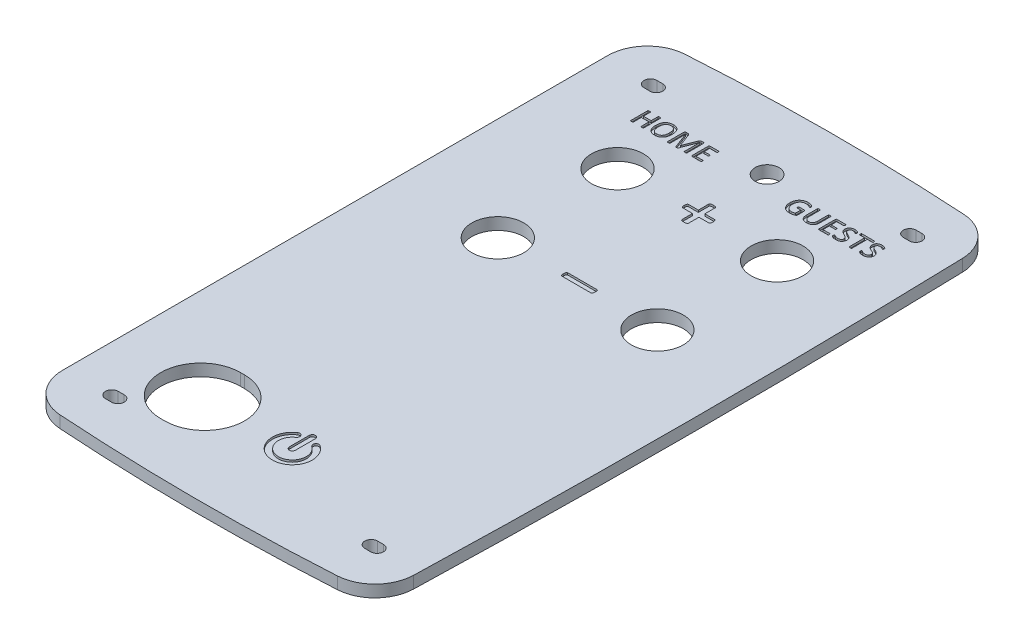
from build123d import *

# Parameters (mm, degrees)
BOSS_EXTRUDE1_DEPTH = 3
BOSS_EXTRUDE2_DEPTH = 17
SKETCH2_R           = 1.6
CUT_EXTRUDE1_DEPTH  = 94.910452487
SKETCH3_R           = 6.5
SKETCH3_R_2         = 10
SKETCH3_R_3         = 3
CUT_EXTRUDE2_DEPTH  = 94.910452487
CUT_EXTRUDE3_DEPTH  = 94.910452487
CUT_EXTRUDE4_DEPTH  = 0.5
SKETCH7_W           = 101.283018643
SKETCH7_H           = 178.660728539
CUT_EXTRUDE5_DEPTH  = 20


with BuildPart() as part:
    # Sketch1 → Boss-Extrude1 (new body)
    with BuildSketch(Plane(origin=(0, 0, 0), x_dir=(1, 0, 0), z_dir=(0, 1, 0))):
        with BuildLine():
            Line((-45.796334169, 68.322010608), (-45.796334169, -68.322010608))
            ThreePointArc((-45.796334169, -68.322010608), (-43.098087267, -75.154609066), (-36.459453831, -78.3))
            ThreePointArc((-36.459453831, -78.3), (-1.576004719, -79.507922129), (33.313795952, -78.5))
            ThreePointArc((33.313795952, -78.5), (39.889666899, -75.4769697), (42.703665831, -68.808971431))
            ThreePointArc((42.703665831, -68.808971431), (43.703665831, 0), (42.703665831, 68.808971431))
            ThreePointArc((42.703665831, 68.808971431), (39.889666899, 75.4769697), (33.313795952, 78.5))
            ThreePointArc((33.313795952, 78.5), (-1.576004719, 79.507922129), (-36.459453831, 78.3))
            ThreePointArc((-36.459453831, 78.3), (-43.098087267, 75.154609066), (-45.796334169, 68.322010608))
        make_face()
    extrude(amount=BOSS_EXTRUDE1_DEPTH)


with BuildPart() as body_2:
    # Sketch1<2> → Boss-Extrude2 (new body)
    with BuildSketch(Plane(origin=(0, 0, 0), x_dir=(1, 0, 0), z_dir=(0, 1, 0))):
        with BuildLine():
            Line((-45.796334169, 68.322010608), (-45.796334169, -68.322010608))
            ThreePointArc((-45.796334169, -68.322010608), (-43.098087267, -75.154609066), (-36.459453831, -78.3))
            ThreePointArc((-36.459453831, -78.3), (-1.576004719, -79.507922129), (33.313795952, -78.5))
            ThreePointArc((33.313795952, -78.5), (39.889666899, -75.4769697), (42.703665831, -68.808971431))
            ThreePointArc((42.703665831, -68.808971431), (43.703665831, 0), (42.703665831, 68.808971431))
            ThreePointArc((42.703665831, 68.808971431), (39.889666899, 75.4769697), (33.313795952, 78.5))
            ThreePointArc((33.313795952, 78.5), (-1.576004719, 79.507922129), (-36.459453831, 78.3))
            ThreePointArc((-36.459453831, 78.3), (-43.098087267, 75.154609066), (-45.796334169, 68.322010608))
        make_face()
    extrude(amount=-BOSS_EXTRUDE2_DEPTH)


with BuildPart() as cut_extrude1_tool:
    # Sketch2 → Cut-Extrude1 (new, through all)
    with BuildSketch(Plane(origin=(0, 3, 0), x_dir=(1, 0, 0), z_dir=(0, 1, 0))):
        with Locations((-33.5, 67.5)):
            Circle(SKETCH2_R)
        with Locations((-33.5, -67.5)):
            Circle(SKETCH2_R)
        with Locations((31.5, -67.5)):
            Circle(SKETCH2_R)
        with Locations((31.5, 67.5)):
            Circle(SKETCH2_R)
    extrude(amount=-CUT_EXTRUDE1_DEPTH)


with BuildPart() as part_1:
    add(part.part)

    # Cut-Extrude1: cut by cut_extrude1_tool
    add(cut_extrude1_tool.part, mode=Mode.SUBTRACT)


with BuildPart() as body_2_1:
    add(body_2.part)

    # Cut-Extrude1: cut by cut_extrude1_tool
    add(cut_extrude1_tool.part, mode=Mode.SUBTRACT)


with BuildPart() as cut_extrude2_tool:
    # Sketch3 → Cut-Extrude2 (new, through all)
    with BuildSketch(Plane(origin=(0, 3, 0), x_dir=(1, 0, 0), z_dir=(0, 1, 0))):
        with Locations((20, 45)):
            Circle(SKETCH3_R)
        with Locations((-20, 45)):
            Circle(SKETCH3_R)
        with Locations((20, 15)):
            Circle(SKETCH3_R)
        with Locations((-20, 15)):
            Circle(SKETCH3_R)
        with Locations((-22.5, -56.5)):
            Circle(SKETCH3_R_2)
        with Locations((0, 62.5)):
            Circle(SKETCH3_R_3)
    extrude(amount=-CUT_EXTRUDE2_DEPTH)


with BuildPart() as part_2:
    add(part_1.part)

    # Cut-Extrude2: cut by cut_extrude2_tool
    add(cut_extrude2_tool.part, mode=Mode.SUBTRACT)


with BuildPart() as body_2_2:
    add(body_2_1.part)

    # Cut-Extrude2: cut by cut_extrude2_tool
    add(cut_extrude2_tool.part, mode=Mode.SUBTRACT)


with BuildPart() as cut_extrude3_tool:
    # Sketch4 → Cut-Extrude3 (new, through all)
    with BuildSketch(Plane(origin=(0, 3, 0), x_dir=(1, 0, 0), z_dir=(0, 1, 0))):
        with BuildLine():
            Line((-23, -46.5), (-22, -46.5))
            ThreePointArc((-22, -46.5), (-12, -56.5), (-22, -66.5))
            Line((-22, -66.5), (-23, -66.5))
            ThreePointArc((-23, -66.5), (-33, -56.5), (-23, -46.5))
        make_face()
        with BuildLine():
            Line((-34.25, -65.9), (-32.75, -65.9))
            ThreePointArc((-32.75, -65.9), (-31.15, -67.5), (-32.75, -69.1))
            Line((-32.75, -69.1), (-34.25, -69.1))
            ThreePointArc((-34.25, -69.1), (-35.85, -67.5), (-34.25, -65.9))
        make_face()
        with BuildLine():
            Line((30.75, -65.9), (32.25, -65.9))
            ThreePointArc((32.25, -65.9), (33.85, -67.5), (32.25, -69.1))
            Line((32.25, -69.1), (30.75, -69.1))
            ThreePointArc((30.75, -69.1), (29.15, -67.5), (30.75, -65.9))
        make_face()
        with BuildLine():
            Line((-34.25, 69.1), (-32.75, 69.1))
            ThreePointArc((-32.75, 69.1), (-31.15, 67.5), (-32.75, 65.9))
            Line((-32.75, 65.9), (-34.25, 65.9))
            ThreePointArc((-34.25, 65.9), (-35.85, 67.5), (-34.25, 69.1))
        make_face()
        with BuildLine():
            Line((30.75, 69.1), (32.25, 69.1))
            ThreePointArc((32.25, 69.1), (33.85, 67.5), (32.25, 65.9))
            Line((32.25, 65.9), (30.75, 65.9))
            ThreePointArc((30.75, 65.9), (29.15, 67.5), (30.75, 69.1))
        make_face()
    extrude(amount=-CUT_EXTRUDE3_DEPTH)


with BuildPart() as part_3:
    add(part_2.part)

    # Cut-Extrude3: cut by cut_extrude3_tool
    add(cut_extrude3_tool.part, mode=Mode.SUBTRACT)

    # Sketch6 → Cut-Extrude4 (cut)
    # profile 1 of 14: a face of its own
    with BuildSketch(Plane(origin=(0, 3, 0), x_dir=(1, 0, 0), z_dir=(0, 1, 0))):
        with BuildLine():
            Line((0.75, -51.5), (0.75, -56.5))
            ThreePointArc((0.75, -56.5), (0, -57.25), (-0.75, -56.5))
            Line((-0.75, -56.5), (-0.75, -51.5))
            ThreePointArc((-0.75, -51.5), (0, -50.75), (0.75, -51.5))
        make_face()
    # profile 2 of 14: a face of its own
    with BuildSketch(Plane(origin=(0, 3, 0), x_dir=(1, 0, 0), z_dir=(0, 1, 0))):
        with BuildLine():
            ThreePointArc((-2.836367871, -52.382352941), (0, -61.5), (2.836367871, -52.382352941))
            ThreePointArc((2.836367871, -52.382352941), (1.793265631, -52.574544819), (1.98545751, -53.617647059))
            ThreePointArc((1.98545751, -53.617647059), (0, -60), (-1.98545751, -53.617647059))
            ThreePointArc((-1.98545751, -53.617647059), (-1.793265631, -52.574544819), (-2.836367871, -52.382352941))
        make_face()
    # profile 3 of 14: a face of its own
    with BuildSketch(Plane(origin=(0, 3, 0), x_dir=(1, 0, 0), z_dir=(0, 1, 0))):
        with BuildLine():
            add(Edge.make_bspline(
                [(-25.558823529, 57.110638787), (-25.559684608, 57.10191743), (-25.561382235, 57.084723161), (-25.573400426, 57.059897318), (-25.597507046, 57.040755251), (-25.631830038, 57.02672435), (-25.677936125, 57.017804608), (-25.735188165, 57.006450632), (-25.806895175, 57.001010036), (-25.859028245, 57.000357887), (-25.887637868, 57)],
                knots=[0, 0, 0, 0, 0.555183087, 1.094550744, 1.701060695, 2.466987252, 3.435071453, 4.68248791, 6.179413357, 8, 8, 8, 8], degree=3))
            add(Edge.make_bspline(
                [(-25.887637868, 57), (-25.917967673, 57.000347602), (-25.972162383, 57.000968713), (-26.045294027, 57.006222938), (-26.10258037, 57.017855015), (-26.147962814, 57.027519315), (-26.182128957, 57.042039117), (-26.206017388, 57.06092085), (-26.218028042, 57.085759744), (-26.219726656, 57.102952304), (-26.220588235, 57.111672794)],
                knots=[0, 0, 0, 0, 1.907610173, 3.408606684, 4.598780777, 5.581686739, 6.318846301, 6.91825845, 7.451314051, 8, 8, 8, 8], degree=3))
            Line((-26.220588235, 57.111672794), (-26.220588235, 59.117647059))
            Line((-26.220588235, 59.117647059), (-28.139705882, 59.117647059))
            Line((-28.139705882, 59.117647059), (-28.139705882, 57.111672794))
            add(Edge.make_bspline(
                [(-28.139705882, 57.111672794), (-28.140556891, 57.102938917), (-28.142234664, 57.085719963), (-28.154286612, 57.061321297), (-28.177351805, 57.041370655), (-28.211910781, 57.028103463), (-28.257553076, 57.017304562), (-28.315427576, 57.006557089), (-28.38810797, 57.000945866), (-28.441283826, 57.000336057), (-28.470588235, 57)],
                knots=[0, 0, 0, 0, 0.551432386, 1.087156187, 1.673203308, 2.433955425, 3.400665773, 4.639654944, 6.148164666, 8, 8, 8, 8], degree=3))
            add(Edge.make_bspline(
                [(-28.470588235, 57), (-28.499192519, 57.000399244), (-28.552002328, 57.001136337), (-28.624456623, 57.006214252), (-28.682624902, 57.018073879), (-28.728978243, 57.026273712), (-28.763000263, 57.041050639), (-28.786902092, 57.059877154), (-28.798909817, 57.084728118), (-28.800608815, 57.101919098), (-28.801470588, 57.110638787)],
                knots=[0, 0, 0, 0, 1.810397557, 3.34239271, 4.582827882, 5.566745421, 6.308459453, 6.911575013, 7.447924048, 8, 8, 8, 8], degree=3))
            Line((-28.801470588, 57.110638787), (-28.801470588, 61.389361213))
            add(Edge.make_bspline(
                [(-28.801470588, 61.389361213), (-28.800611024, 61.398086472), (-28.798916381, 61.415288435), (-28.786875397, 61.440055518), (-28.76323562, 61.459176862), (-28.728507855, 61.471999284), (-28.682998106, 61.482874453), (-28.624192873, 61.491767708), (-28.552123048, 61.499527435), (-28.499223729, 61.499834032), (-28.470588235, 61.5)],
                knots=[0, 0, 0, 0, 0.552440226, 1.089143157, 1.692656667, 2.42614887, 3.415780176, 4.653384476, 6.188407898, 8, 8, 8, 8], degree=3))
            add(Edge.make_bspline(
                [(-28.470588235, 61.5), (-28.441270885, 61.49972777), (-28.388071548, 61.499233781), (-28.315591427, 61.492923109), (-28.257374333, 61.484158803), (-28.212246084, 61.472481133), (-28.17709393, 61.460886253), (-28.154675743, 61.440836138), (-28.142190566, 61.417484504), (-28.140541258, 61.400875633), (-28.139705882, 61.392463235)],
                knots=[0, 0, 0, 0, 1.864183799, 3.38275261, 4.626336672, 5.599493267, 6.356796548, 6.946751567, 7.466529424, 8, 8, 8, 8], degree=3))
            Line((-28.139705882, 61.392463235), (-28.139705882, 59.647058824))
            Line((-28.139705882, 59.647058824), (-26.220588235, 59.647058824))
            Line((-26.220588235, 59.647058824), (-26.220588235, 61.392463235))
            add(Edge.make_bspline(
                [(-26.220588235, 61.392463235), (-26.219742883, 61.400863074), (-26.218073877, 61.41744715), (-26.205616331, 61.441225252), (-26.182398877, 61.460228702), (-26.1476101, 61.47304771), (-26.102766995, 61.483622154), (-26.045121935, 61.493243839), (-25.972202968, 61.499225406), (-25.917982237, 61.499722054), (-25.887637868, 61.5)],
                knots=[0, 0, 0, 0, 0.530819962, 1.04801524, 1.651431642, 2.38480582, 3.374277889, 4.568622803, 6.079646421, 8, 8, 8, 8], degree=3))
            add(Edge.make_bspline(
                [(-25.887637868, 61.5), (-25.85899601, 61.499881428), (-25.806771376, 61.499665227), (-25.735450388, 61.491542276), (-25.677561992, 61.483140598), (-25.632290449, 61.47155059), (-25.597278667, 61.459473303), (-25.573425967, 61.440036378), (-25.561375956, 61.41529314), (-25.559682495, 61.398088056), (-25.558823529, 61.389361213)],
                knots=[0, 0, 0, 0, 1.82170296, 3.321634079, 4.566145697, 5.540028143, 6.297896277, 6.904778117, 7.444476495, 8, 8, 8, 8], degree=3))
            Line((-25.558823529, 61.389361213), (-25.558823529, 57.110638787))
        make_face()
    # profile 4 of 14: a face of its own
    with BuildSketch(Plane(origin=(0, 3, 0), x_dir=(1, 0, 0), z_dir=(0, 1, 0))):
        with BuildLine():
            add(Edge.make_bspline(
                [(-20.595588235, 59.301700368), (-20.597208877, 59.21306862), (-20.600380529, 59.039613155), (-20.624170074, 58.786276296), (-20.664266186, 58.545989301), (-20.720886147, 58.319815778), (-20.792624679, 58.107900425), (-20.881810422, 57.912557633), (-20.986868299, 57.733487513), (-21.106704797, 57.569893256), (-21.244284074, 57.424128066), (-21.398001502, 57.29620588), (-21.568830583, 57.186859068), (-21.755126695, 57.094642975), (-21.958069086, 57.022060787), (-22.176903354, 56.97078016), (-22.411766436, 56.939282507), (-22.573886601, 56.935679521), (-22.657398897, 56.933823529)],
                knots=[0, 0, 0, 0, 1.19137641, 2.331565767, 3.417042525, 4.463281839, 5.462606823, 6.420512668, 7.344711138, 8.249186097, 9.140739235, 10.032400728, 10.93079057, 11.861193805, 12.821170558, 13.821397441, 14.877745384, 16, 16, 16, 16], degree=3))
            add(Edge.make_bspline(
                [(-22.657398897, 56.933823529), (-22.739532183, 56.935358723), (-22.898828996, 56.938336219), (-23.128828887, 56.968381744), (-23.342334931, 57.013519471), (-23.538335094, 57.080098775), (-23.717108493, 57.16529764), (-23.880221284, 57.267220728), (-24.026818075, 57.386728781), (-24.157268594, 57.523679455), (-24.271864636, 57.677662003), (-24.368628722, 57.849979671), (-24.451936486, 58.038164438), (-24.518717553, 58.244064308), (-24.570059579, 58.466589438), (-24.605111091, 58.705581154), (-24.628877342, 58.959999685), (-24.631173152, 59.135167319), (-24.632352941, 59.225183824)],
                knots=[0, 0, 0, 0, 1.137445095, 2.206065128, 3.208407631, 4.156851521, 5.066857725, 5.946688419, 6.815641936, 7.680385637, 8.56104548, 9.467951058, 10.41303433, 11.408286435, 12.462476973, 13.573548823, 14.753076423, 16, 16, 16, 16], degree=3))
            add(Edge.make_bspline(
                [(-24.632352941, 59.225183824), (-24.63075952, 59.312096627), (-24.627648659, 59.481777752), (-24.603512581, 59.730251825), (-24.563770247, 59.966472647), (-24.506650687, 60.190074595), (-24.435644326, 60.400200594), (-24.345722881, 60.593803308), (-24.241516506, 60.771944496), (-24.119755105, 60.933347895), (-23.981664427, 61.077733218), (-23.827424551, 61.205097562), (-23.656654376, 61.313819582), (-23.470259308, 61.405393219), (-23.267516305, 61.478143074), (-23.047912302, 61.529178386), (-22.812380571, 61.560679382), (-22.649918563, 61.564310119), (-22.56640625, 61.566176471)],
                knots=[0, 0, 0, 0, 1.175256309, 2.294469895, 3.372697637, 4.411680733, 5.412616409, 6.367821432, 7.293569431, 8.198811264, 9.095564309, 9.989623777, 10.897346502, 11.827111084, 12.792869429, 13.803655498, 14.870986452, 16, 16, 16, 16], degree=3))
            add(Edge.make_bspline(
                [(-22.56640625, 61.566176471), (-22.486019175, 61.564468505), (-22.329901967, 61.56115152), (-22.103667666, 61.5333271), (-21.893815959, 61.48583941), (-21.699730708, 61.420391788), (-21.520914138, 61.338089671), (-21.358064886, 61.236530631), (-21.210146345, 61.118543374), (-21.079144656, 60.981677118), (-20.964043963, 60.828194009), (-20.862474598, 60.659110375), (-20.780856787, 60.471082444), (-20.712176049, 60.267799864), (-20.660340315, 60.047822593), (-20.622279619, 59.812902141), (-20.59919167, 59.562388067), (-20.596813355, 59.390330668), (-20.595588235, 59.301700368)],
                knots=[0, 0, 0, 0, 1.124252185, 2.183374782, 3.182256192, 4.129105229, 5.043721226, 5.929425601, 6.80741917, 7.683782861, 8.571911764, 9.486451506, 10.436181025, 11.433338738, 12.484662547, 13.593591443, 14.760409517, 16, 16, 16, 16], degree=3))
        make_face()
        with BuildLine():
            add(Edge.make_bspline(
                [(-21.257352941, 59.257238051), (-21.258159571, 59.319295248), (-21.259747602, 59.441468718), (-21.271899757, 59.621369235), (-21.294246667, 59.794457856), (-21.322363776, 59.960386936), (-21.359560017, 60.118318998), (-21.410924555, 60.265348718), (-21.471309568, 60.402671177), (-21.544225746, 60.528428026), (-21.6277035, 60.643509707), (-21.725943869, 60.744695507), (-21.837523933, 60.831851204), (-21.961883113, 60.906233306), (-22.100766059, 60.965667194), (-22.254835668, 61.007613789), (-22.424280344, 61.032518749), (-22.542190662, 61.035310172), (-22.603630515, 61.036764706)],
                knots=[0, 0, 0, 0, 1.169250427, 2.301930944, 3.395008842, 4.456274514, 5.472222399, 6.447763327, 7.38673591, 8.294558986, 9.18170536, 10.058907655, 10.942338117, 11.842252221, 12.781965628, 13.779311434, 14.842859721, 16, 16, 16, 16], degree=3))
            add(Edge.make_bspline(
                [(-22.603630515, 61.036764706), (-22.665090226, 61.035062736), (-22.783128722, 61.031793961), (-22.952994331, 61.004516923), (-23.107686096, 60.959838989), (-23.247139816, 60.895679557), (-23.371338217, 60.816492229), (-23.483725426, 60.72519897), (-23.584154181, 60.622107228), (-23.671064215, 60.506007572), (-23.747173752, 60.380036552), (-23.811159294, 60.243443023), (-23.862530931, 60.096293248), (-23.903921807, 59.940755556), (-23.932697439, 59.7776253), (-23.954461591, 59.609947637), (-23.968538104, 59.438084658), (-23.969900084, 59.32206293), (-23.970588235, 59.263442096)],
                knots=[0, 0, 0, 0, 1.161109193, 2.230006939, 3.242146217, 4.195396554, 5.120768157, 6.019191557, 6.926803525, 7.833666984, 8.754302376, 9.704386277, 10.67901314, 11.696672534, 12.743199842, 13.807421854, 14.892183724, 16, 16, 16, 16], degree=3))
            add(Edge.make_bspline(
                [(-23.970588235, 59.263442096), (-23.969852996, 59.199309804), (-23.968408764, 59.073334567), (-23.955329927, 58.88845568), (-23.936470237, 58.710917431), (-23.907780964, 58.541970806), (-23.869810517, 58.382164022), (-23.82198677, 58.232907662), (-23.7613177, 58.095219941), (-23.690389193, 57.968355618), (-23.606662693, 57.853802358), (-23.508984308, 57.753210633), (-23.398713077, 57.666144917), (-23.275382462, 57.591306779), (-23.136069803, 57.533159748), (-22.980881997, 57.492552147), (-22.809526881, 57.467375152), (-22.689891074, 57.464655566), (-22.627412684, 57.463235294)],
                knots=[0, 0, 0, 0, 1.196993268, 2.351257178, 3.458234918, 4.528672635, 5.547698982, 6.522289971, 7.449941179, 8.351729023, 9.230641879, 10.090605086, 10.960784804, 11.846827774, 12.775304165, 13.767908032, 14.834316289, 16, 16, 16, 16], degree=3))
            add(Edge.make_bspline(
                [(-22.627412684, 57.463235294), (-22.565612496, 57.464963077), (-22.446556092, 57.468291604), (-22.275286746, 57.495354974), (-22.119241368, 57.540159758), (-21.978799961, 57.604355295), (-21.852817118, 57.683701517), (-21.739862927, 57.776007614), (-21.639123023, 57.880548711), (-21.552241157, 57.998061475), (-21.478203112, 58.127420764), (-21.413574826, 58.265369051), (-21.363363272, 58.414128887), (-21.323220942, 58.570771363), (-21.294140143, 58.735109837), (-21.272060405, 58.90482841), (-21.259763567, 59.079549098), (-21.258162127, 59.197592401), (-21.257352941, 59.257238051)],
                knots=[0, 0, 0, 0, 1.156546549, 2.228055893, 3.236790421, 4.186873135, 5.108930184, 6.01699397, 6.911520701, 7.820111692, 8.745392135, 9.698166525, 10.66751403, 11.680142067, 12.723095794, 13.790029056, 14.883332216, 16, 16, 16, 16], degree=3))
        make_face(mode=Mode.SUBTRACT)
    # profile 5 of 14: a face of its own
    with BuildSketch(Plane(origin=(0, 3, 0), x_dir=(1, 0, 0), z_dir=(0, 1, 0))):
        with BuildLine():
            add(Edge.make_bspline(
                [(-14.705882353, 57.110638787), (-14.70665627, 57.101870858), (-14.708196217, 57.084424366), (-14.721708775, 57.060181338), (-14.745476877, 57.040691369), (-14.779967786, 57.026740153), (-14.825686401, 57.017907708), (-14.882575917, 57.006334633), (-14.95533472, 57.000937987), (-15.008845347, 57.000336868), (-15.038832721, 57)],
                knots=[0, 0, 0, 0, 0.549940415, 1.094275647, 1.695058239, 2.453752044, 3.41269449, 4.626954335, 6.109744105, 8, 8, 8, 8], degree=3))
            add(Edge.make_bspline(
                [(-15.038832721, 57), (-15.067093442, 57.000401774), (-15.119560431, 57.001147682), (-15.19165738, 57.006256445), (-15.249532646, 57.017892344), (-15.295455888, 57.026452623), (-15.329178495, 57.041042296), (-15.353078188, 57.05987893), (-15.36508638, 57.084727682), (-15.366785316, 57.101918951), (-15.367647059, 57.110638787)],
                knots=[0, 0, 0, 0, 1.798275377, 3.338559297, 4.58570577, 5.553580443, 6.299307474, 6.905686155, 7.444937074, 8, 8, 8, 8], degree=3))
            Line((-15.367647059, 57.110638787), (-15.367647059, 61.011948529))
            Line((-15.367647059, 61.011948529), (-15.37488511, 61.011948529))
            Line((-15.37488511, 61.011948529), (-16.882467831, 57.093060662))
            add(Edge.make_bspline(
                [(-16.882467831, 57.093060662), (-16.886298337, 57.085619515), (-16.894166552, 57.070334712), (-16.912327722, 57.050659177), (-16.936681089, 57.032607093), (-16.969606425, 57.020419897), (-17.010013605, 57.011444093), (-17.057340952, 57.004232207), (-17.113326906, 57.000221513), (-17.153370868, 57.0000779), (-17.175091912, 57)],
                knots=[0, 0, 0, 0, 0.617868315, 1.269158706, 1.964077171, 2.846421734, 3.844013633, 5.032644331, 6.390417486, 8, 8, 8, 8], degree=3))
            add(Edge.make_bspline(
                [(-17.175091912, 57), (-17.197839224, 57.00055999), (-17.239927582, 57.001596116), (-17.298452357, 57.004883426), (-17.347247523, 57.013121206), (-17.386973301, 57.024018184), (-17.417975798, 57.038107077), (-17.442878509, 57.05265474), (-17.458853449, 57.072414989), (-17.465548557, 57.086381978), (-17.46875, 57.093060662)],
                knots=[0, 0, 0, 0, 1.684713544, 3.117151853, 4.33356902, 5.342914851, 6.153770431, 6.85436779, 7.4521858, 8, 8, 8, 8], degree=3))
            Line((-17.46875, 57.093060662), (-18.937040441, 61.011948529))
            Line((-18.937040441, 61.011948529), (-18.941176471, 61.011948529))
            Line((-18.941176471, 61.011948529), (-18.941176471, 57.110638787))
            add(Edge.make_bspline(
                [(-18.941176471, 57.110638787), (-18.941950418, 57.101870986), (-18.943490424, 57.084424749), (-18.957002524, 57.060179758), (-18.980772711, 57.04069873), (-19.015567512, 57.026572783), (-19.062036187, 57.017981131), (-19.120278378, 57.006248719), (-19.194083762, 57.001025405), (-19.248277449, 57.000365259), (-19.278262868, 57)],
                knots=[0, 0, 0, 0, 0.544103173, 1.082660658, 1.677066352, 2.427707141, 3.397415481, 4.619936966, 6.129807882, 8, 8, 8, 8], degree=3))
            add(Edge.make_bspline(
                [(-19.278262868, 57), (-19.307211429, 57.000384341), (-19.360022136, 57.001085491), (-19.432142208, 57.006198032), (-19.489269307, 57.018055879), (-19.534628328, 57.026243479), (-19.567670773, 57.041028538), (-19.590603182, 57.059983136), (-19.601420242, 57.084899278), (-19.602427305, 57.101942296), (-19.602941176, 57.110638787)],
                knots=[0, 0, 0, 0, 1.8533371, 3.381033053, 4.614072809, 5.587846392, 6.318072483, 6.911573342, 7.444611737, 8, 8, 8, 8], degree=3))
            Line((-19.602941176, 57.110638787), (-19.602941176, 61.230124081))
            add(Edge.make_bspline(
                [(-19.602941176, 61.230124081), (-19.602140184, 61.252654977), (-19.600638744, 61.294888571), (-19.58473055, 61.352844745), (-19.560226103, 61.402144585), (-19.522229302, 61.438102693), (-19.480138827, 61.46563354), (-19.434813698, 61.485981882), (-19.387039876, 61.497295202), (-19.354488898, 61.499099209), (-19.338235294, 61.5)],
                knots=[0, 0, 0, 0, 1.261982118, 2.365553467, 3.35280749, 4.310975745, 5.26129003, 6.171318277, 7.086888644, 8, 8, 8, 8], degree=3))
            Line((-19.338235294, 61.5), (-18.949448529, 61.5))
            add(Edge.make_bspline(
                [(-18.949448529, 61.5), (-18.911809439, 61.499188007), (-18.841675397, 61.497674995), (-18.742907565, 61.482012851), (-18.656643221, 61.456068969), (-18.5828096, 61.415482047), (-18.518871497, 61.364820537), (-18.468979862, 61.298609472), (-18.426118505, 61.222289292), (-18.404477897, 61.165663672), (-18.393152574, 61.136029412)],
                knots=[0, 0, 0, 0, 1.24751318, 2.324528587, 3.308036964, 4.218670816, 5.104345063, 5.991788597, 6.949029422, 8, 8, 8, 8], degree=3))
            Line((-18.393152574, 61.136029412), (-17.154411765, 57.893382353))
            Line((-17.154411765, 57.893382353), (-17.13683364, 57.893382353))
            Line((-17.13683364, 57.893382353), (-15.877412684, 61.125689338))
            add(Edge.make_bspline(
                [(-15.877412684, 61.125689338), (-15.863574585, 61.158046332), (-15.837524897, 61.218957123), (-15.791051265, 61.300619439), (-15.740160623, 61.367484539), (-15.683404339, 61.419348404), (-15.620705987, 61.458063338), (-15.55047705, 61.482671092), (-15.47200683, 61.497309998), (-15.416661739, 61.49906743), (-15.387293199, 61.5)],
                knots=[0, 0, 0, 0, 1.266394147, 2.383938095, 3.374429421, 4.279357972, 5.137103734, 6.00865411, 6.943304242, 8, 8, 8, 8], degree=3))
            Line((-15.387293199, 61.5), (-14.978860294, 61.5))
            add(Edge.make_bspline(
                [(-14.978860294, 61.5), (-14.960532464, 61.499144927), (-14.92455095, 61.497466232), (-14.872750506, 61.486113341), (-14.825217164, 61.467055513), (-14.785286144, 61.436785721), (-14.750909289, 61.399193193), (-14.726933877, 61.351131563), (-14.707193434, 61.294676359), (-14.706341772, 61.252743998), (-14.705882353, 61.230124081)],
                knots=[0, 0, 0, 0, 1.011400516, 1.985599013, 2.915098522, 3.813295393, 4.72984914, 5.700323623, 6.759466748, 8, 8, 8, 8], degree=3))
            Line((-14.705882353, 61.230124081), (-14.705882353, 57.110638787))
        make_face()
    # profile 6 of 14: a face of its own
    with BuildSketch(Plane(origin=(0, 3, 0), x_dir=(1, 0, 0), z_dir=(0, 1, 0))):
        with BuildLine():
            add(Edge.make_bspline(
                [(-11, 57.262637868), (-11.000436106, 57.24193896), (-11.001258936, 57.202885029), (-11.00618474, 57.148626008), (-11.014227167, 57.101697967), (-11.030631847, 57.064802697), (-11.047274394, 57.034316512), (-11.069547073, 57.013746783), (-11.095257016, 57.002692576), (-11.112953509, 57.000911689), (-11.122012868, 57)],
                knots=[0, 0, 0, 0, 1.551039663, 2.926444145, 4.08677933, 5.09439548, 5.940707236, 6.67238136, 7.320352757, 8, 8, 8, 8], degree=3))
            Line((-11.122012868, 57), (-13.291360294, 57))
            add(Edge.make_bspline(
                [(-13.291360294, 57), (-13.318002397, 57.002745423), (-13.372635001, 57.008375219), (-13.434992296, 57.043404306), (-13.477007375, 57.085294742), (-13.49958757, 57.129244153), (-13.513193437, 57.182899207), (-13.514174287, 57.221870386), (-13.514705882, 57.242991728)],
                knots=[0, 0, 0, 0, 1.283024327, 2.630984544, 3.348831971, 4.123093912, 4.982766836, 6, 6, 6, 6], degree=3))
            Line((-13.514705882, 57.242991728), (-13.514705882, 61.257008272))
            add(Edge.make_bspline(
                [(-13.514705882, 61.257008272), (-13.514353852, 61.278191358), (-13.513702815, 61.317366784), (-13.497960392, 61.370219062), (-13.477293762, 61.415360688), (-13.433410011, 61.456272384), (-13.370641849, 61.491735376), (-13.315281774, 61.497289034), (-13.288258272, 61.5)],
                knots=[0, 0, 0, 0, 1.010614797, 1.869003608, 2.630550752, 3.355321731, 4.709025054, 6, 6, 6, 6], degree=3))
            Line((-13.288258272, 61.5), (-11.119944853, 61.5))
            add(Edge.make_bspline(
                [(-11.119944853, 61.5), (-11.110820385, 61.499203946), (-11.092852681, 61.497636374), (-11.068201189, 61.484835314), (-11.044676116, 61.466335729), (-11.030896569, 61.434787859), (-11.016472046, 61.397637154), (-11.008721587, 61.350218663), (-11.000309092, 61.293835794), (-11.000108938, 61.252578941), (-11, 61.230124081)],
                knots=[0, 0, 0, 0, 0.668354669, 1.316109436, 2.018833227, 2.825881518, 3.798343768, 4.964302348, 6.347761332, 8, 8, 8, 8], degree=3))
            add(Edge.make_bspline(
                [(-11, 61.230124081), (-11.000151976, 61.209057951), (-11.000434604, 61.169881559), (-11.00861042, 61.11580189), (-11.016998366, 61.070209689), (-11.029075548, 61.033413594), (-11.044799726, 61.004521292), (-11.065325965, 60.984417883), (-11.090366937, 60.973122064), (-11.107771572, 60.971456384), (-11.116842831, 60.970588235)],
                knots=[0, 0, 0, 0, 1.608836867, 2.991931757, 4.175795774, 5.151123556, 5.94236908, 6.669547864, 7.306571131, 8, 8, 8, 8], degree=3))
            Line((-11.116842831, 60.970588235), (-12.852941176, 60.970588235))
            Line((-12.852941176, 60.970588235), (-12.852941176, 59.580882353))
            Line((-12.852941176, 59.580882353), (-11.380514706, 59.580882353))
            add(Edge.make_bspline(
                [(-11.380514706, 59.580882353), (-11.37137823, 59.580136926), (-11.353698892, 59.578694504), (-11.329883713, 59.565726889), (-11.308778986, 59.548280568), (-11.291835037, 59.522763204), (-11.278068686, 59.489994704), (-11.271078874, 59.447720635), (-11.265843484, 59.397312763), (-11.265103148, 59.360660366), (-11.264705882, 59.340992647)],
                knots=[0, 0, 0, 0, 0.736172937, 1.424515283, 2.159090736, 2.943172998, 3.883905225, 5.025477629, 6.403867899, 8, 8, 8, 8], degree=3))
            add(Edge.make_bspline(
                [(-11.264705882, 59.340992647), (-11.265098001, 59.322358142), (-11.265825884, 59.287767243), (-11.271097486, 59.240105716), (-11.278204482, 59.199913757), (-11.291847143, 59.168475003), (-11.308582686, 59.144073631), (-11.329809957, 59.128159553), (-11.354363342, 59.11937341), (-11.371479632, 59.118243499), (-11.380514706, 59.117647059)],
                knots=[0, 0, 0, 0, 1.579906653, 2.932752572, 4.068131091, 5.024067173, 5.819412736, 6.550349844, 7.234781805, 8, 8, 8, 8], degree=3))
            Line((-11.380514706, 59.117647059), (-12.852941176, 59.117647059))
            Line((-12.852941176, 59.117647059), (-12.852941176, 57.529411765))
            Line((-12.852941176, 57.529411765), (-11.117876838, 57.529411765))
            add(Edge.make_bspline(
                [(-11.117876838, 57.529411765), (-11.109104594, 57.52860627), (-11.091809999, 57.527018226), (-11.067983463, 57.514287577), (-11.046220829, 57.49500604), (-11.029615558, 57.466139218), (-11.014171797, 57.430021398), (-11.006082651, 57.383560502), (-11.001128882, 57.326871635), (-11.000400128, 57.285405266), (-11, 57.262637868)],
                knots=[0, 0, 0, 0, 0.651958213, 1.285344175, 1.978227372, 2.799835326, 3.746680766, 4.903175595, 6.299666972, 8, 8, 8, 8], degree=3))
        make_face()
    # profile 7 of 14: a face of its own
    with BuildSketch(Plane(origin=(0, 3, 0), x_dir=(1, 0, 0), z_dir=(0, 1, 0))):
        with BuildLine():
            add(Edge.make_bspline(
                [(12.621323529, 60.885799632), (12.620890382, 60.866484001), (12.620068815, 60.829847297), (12.615039443, 60.778687127), (12.607295344, 60.734445455), (12.595300941, 60.698428275), (12.58018468, 60.67028954), (12.560912272, 60.651502356), (12.538781065, 60.641471656), (12.523528196, 60.640296886), (12.515854779, 60.639705882)],
                knots=[0, 0, 0, 0, 1.573202425, 2.983953775, 4.184303726, 5.22307877, 6.065796592, 6.760900965, 7.376633811, 8, 8, 8, 8], degree=3))
            add(Edge.make_bspline(
                [(12.515854779, 60.639705882), (12.507860762, 60.640811712), (12.488925174, 60.643431112), (12.457712027, 60.656067872), (12.419925903, 60.675828725), (12.375744743, 60.703200494), (12.324873107, 60.735842743), (12.264484166, 60.768038237), (12.197156916, 60.804003491), (12.12107866, 60.839486801), (12.037208127, 60.875996857), (11.945216286, 60.911234706), (11.844530919, 60.943715976), (11.736486426, 60.976596908), (11.618844771, 61.003669583), (11.491022274, 61.023270331), (11.352789863, 61.034255354), (11.257142251, 61.035911141), (11.207835478, 61.036764706)],
                knots=[0, 0, 0, 0, 0.278649161, 0.660041846, 1.156499876, 1.75627739, 2.458476522, 3.249142037, 4.124712262, 5.101790403, 6.15500456, 7.292188338, 8.511357846, 9.818120231, 11.202132346, 12.687675243, 14.292481716, 16, 16, 16, 16], degree=3))
            add(Edge.make_bspline(
                [(11.207835478, 61.036764706), (11.148451616, 61.03532873), (11.031853685, 61.032509247), (10.862008721, 61.005874429), (10.701339456, 60.963729647), (10.551067634, 60.904361065), (10.410997377, 60.830869239), (10.2818011, 60.743639065), (10.164542669, 60.642351176), (10.057484882, 60.529336665), (9.962120612, 60.403847206), (9.879553183, 60.266491402), (9.807610006, 60.118512384), (9.748012148, 59.959994675), (9.702013469, 59.791973143), (9.667437446, 59.617215181), (9.647908513, 59.434840303), (9.644910841, 59.311051079), (9.643382353, 59.247931985)],
                knots=[0, 0, 0, 0, 1.066695838, 2.094416304, 3.081682141, 4.04687383, 4.991812804, 5.919660936, 6.84224105, 7.771287927, 8.71295175, 9.669155054, 10.647203761, 11.666656812, 12.70824998, 13.774981797, 14.865481767, 16, 16, 16, 16], degree=3))
            add(Edge.make_bspline(
                [(9.643382353, 59.247931985), (9.64462659, 59.178238215), (9.64704145, 59.042973989), (9.669914773, 58.846053435), (9.703441923, 58.660834519), (9.754909292, 58.488458574), (9.818195505, 58.328934298), (9.891102231, 58.181185073), (9.976596882, 58.046878095), (10.072461055, 57.92543357), (10.179836192, 57.818452893), (10.296230376, 57.724738662), (10.422349369, 57.644386947), (10.558040507, 57.578403203), (10.702157601, 57.526222771), (10.854272921, 57.490948487), (11.012677296, 57.466866528), (11.120886648, 57.46445743), (11.17578125, 57.463235294)],
                knots=[0, 0, 0, 0, 1.261075141, 2.447540898, 3.584326088, 4.664212675, 5.697681307, 6.688222038, 7.641922253, 8.57442717, 9.483254148, 10.37970382, 11.274545354, 12.184207188, 13.105857793, 14.042590268, 15.007006096, 16, 16, 16, 16], degree=3))
            add(Edge.make_bspline(
                [(11.17578125, 57.463235294), (11.242842405, 57.465579574), (11.378721194, 57.470329536), (11.580146472, 57.510800565), (11.777896986, 57.570466287), (11.899383818, 57.634288326), (11.959558824, 57.665900735)],
                knots=[0, 0, 0, 0, 0.982758083, 1.991256752, 3.00502685, 4, 4, 4, 4], degree=3))
            Line((11.959558824, 57.665900735), (11.959558824, 58.985294118))
            Line((11.959558824, 58.985294118), (11.008272059, 58.985294118))
            add(Edge.make_bspline(
                [(11.008272059, 58.985294118), (10.999816924, 58.985657899), (10.983074533, 58.986378238), (10.961149619, 58.999309001), (10.941060024, 59.016401199), (10.925906275, 59.042187116), (10.914988496, 59.074968875), (10.906870543, 59.114908927), (10.901974873, 59.162335533), (10.90116684, 59.19656359), (10.900735294, 59.21484375)],
                knots=[0, 0, 0, 0, 0.713174739, 1.412189225, 2.122309668, 2.956824917, 3.92673539, 5.071770198, 6.436121948, 8, 8, 8, 8], degree=3))
            add(Edge.make_bspline(
                [(10.900735294, 59.21484375), (10.901313953, 59.234485637), (10.902371182, 59.270372019), (10.90536857, 59.32010125), (10.91461291, 59.360883345), (10.92772852, 59.393610441), (10.944569653, 59.418159608), (10.964287211, 59.436456614), (10.989035383, 59.447221129), (11.00713364, 59.448081861), (11.016544118, 59.448529412)],
                knots=[0, 0, 0, 0, 1.616912532, 2.954152977, 4.08883912, 5.041818969, 5.836109388, 6.518854331, 7.229854687, 8, 8, 8, 8], degree=3))
            Line((11.016544118, 59.448529412), (12.413488051, 59.448529412))
            add(Edge.make_bspline(
                [(12.413488051, 59.448529412), (12.426353645, 59.448131589), (12.452265623, 59.447330354), (12.489137679, 59.434493484), (12.525546023, 59.41879106), (12.557280289, 59.39296315), (12.587434678, 59.360727157), (12.605185882, 59.315565946), (12.619790042, 59.264014821), (12.620795493, 59.226351472), (12.621323529, 59.206571691)],
                knots=[0, 0, 0, 0, 0.854457334, 1.720921684, 2.585855987, 3.488263509, 4.434520553, 5.495593496, 6.68475286, 8, 8, 8, 8], degree=3))
            Line((12.621323529, 59.206571691), (12.621323529, 57.498391544))
            add(Edge.make_bspline(
                [(12.621323529, 57.498391544), (12.620254494, 57.470282652), (12.618216621, 57.41669942), (12.597616269, 57.353112091), (12.571512675, 57.30807714), (12.540385064, 57.279526386), (12.50376128, 57.249744543), (12.436280056, 57.21501124), (12.334758446, 57.168753682), (12.194057306, 57.11363911), (12.035527986, 57.061652637), (11.868861292, 57.014604765), (11.698189352, 56.97861209), (11.526224429, 56.953061617), (11.354286221, 56.936840568), (11.239924355, 56.934825969), (11.183019301, 56.933823529)],
                knots=[0, 0, 0, 0, 0.70988168, 1.353228502, 1.67069724, 2.016444119, 2.414658469, 2.864136196, 3.930729263, 5.244076404, 6.68814466, 8.156193357, 9.628934346, 11.103330914, 12.558653187, 14, 14, 14, 14], degree=3))
            add(Edge.make_bspline(
                [(11.183019301, 56.933823529), (11.0984875, 56.935799641), (10.933695498, 56.939652007), (10.693345043, 56.969908686), (10.466960887, 57.020615924), (10.254129891, 57.090286034), (10.057247715, 57.181160585), (9.874798358, 57.287321143), (9.709199508, 57.412958044), (9.558897831, 57.554326373), (9.425937502, 57.713208454), (9.308872605, 57.885937707), (9.208966837, 58.073893408), (9.126493553, 58.275903166), (9.061246473, 58.491551861), (9.015296442, 58.719700912), (8.986586184, 58.960089235), (8.98330046, 59.124457179), (8.981617647, 59.208639706)],
                knots=[0, 0, 0, 0, 1.133265771, 2.209264808, 3.241938858, 4.240156856, 5.205964972, 6.144459965, 7.065112029, 7.987074036, 8.905484442, 9.837401439, 10.780233613, 11.754365916, 12.758812838, 13.796645132, 14.871531902, 16, 16, 16, 16], degree=3))
            add(Edge.make_bspline(
                [(8.981617647, 59.208639706), (8.98358961, 59.295931251), (8.98745208, 59.466908529), (9.01807675, 59.716686493), (9.067249141, 59.954305627), (9.137591553, 60.178608033), (9.226361339, 60.388761424), (9.332132185, 60.583025021), (9.453821104, 60.761294568), (9.591681509, 60.923684911), (9.746642357, 61.068063761), (9.914531109, 61.198026762), (10.09930729, 61.307309848), (10.296827736, 61.40045826), (10.50711216, 61.475617603), (10.729828717, 61.527549394), (10.963149048, 61.560811605), (11.122586364, 61.564367449), (11.203699449, 61.566176471)],
                knots=[0, 0, 0, 0, 1.149054028, 2.250643275, 3.308027604, 4.340030259, 5.340540232, 6.30721347, 7.24750255, 8.177827802, 9.10567035, 10.031501921, 10.967785199, 11.925984504, 12.90346292, 13.901829809, 14.932564457, 16, 16, 16, 16], degree=3))
            add(Edge.make_bspline(
                [(11.203699449, 61.566176471), (11.286592375, 61.564437849), (11.448049543, 61.561051396), (11.679384329, 61.52225315), (11.89009899, 61.472138691), (12.077598293, 61.41382273), (12.238929906, 61.34892275), (12.353761587, 61.287437776), (12.429792431, 61.23804135), (12.476272063, 61.206813395), (12.513013247, 61.177816975), (12.547954828, 61.144185679), (12.581913689, 61.103285934), (12.607166201, 61.044308972), (12.620192358, 60.971172618), (12.620911698, 60.916881806), (12.621323529, 60.885799632)],
                knots=[0, 0, 0, 0, 2.03226492, 3.958404598, 5.741325201, 7.346509703, 8.772830132, 10.002864489, 10.535505979, 10.99773616, 11.376879443, 11.681986354, 12.187966605, 12.668934679, 13.237948335, 14, 14, 14, 14], degree=3))
        make_face()
    # profile 8 of 14: a face of its own
    with BuildSketch(Plane(origin=(0, 3, 0), x_dir=(1, 0, 0), z_dir=(0, 1, 0))):
        with BuildLine():
            add(Edge.make_bspline(
                [(17.121323529, 58.654411765), (17.120106949, 58.588160844), (17.117729528, 58.458694424), (17.094164509, 58.270219822), (17.057850062, 58.092337687), (17.004491664, 57.926401025), (16.938899052, 57.771991724), (16.859050147, 57.63010212), (16.768793741, 57.498904843), (16.663121252, 57.381668394), (16.54637658, 57.276687507), (16.416278672, 57.185865821), (16.274353381, 57.108511522), (16.120614955, 57.044124272), (15.955266886, 56.994498866), (15.778930984, 56.960179842), (15.591919464, 56.93759002), (15.463534018, 56.935101101), (15.397633272, 56.933823529)],
                knots=[0, 0, 0, 0, 1.150110424, 2.247526209, 3.293601763, 4.298870375, 5.269610479, 6.202226024, 7.122230234, 8.029487314, 8.936744395, 9.843507622, 10.778464063, 11.739017696, 12.733246549, 13.771050834, 14.855871762, 16, 16, 16, 16], degree=3))
            add(Edge.make_bspline(
                [(15.397633272, 56.933823529), (15.3372693, 56.935350979), (15.218975555, 56.938344285), (15.045172405, 56.957815621), (14.879959711, 56.992165651), (14.722921452, 57.038354282), (14.575467725, 57.098234406), (14.438908709, 57.171944516), (14.312305521, 57.257240078), (14.196912531, 57.35558974), (14.09427001, 57.468104429), (14.003510029, 57.593182356), (13.925815419, 57.731755591), (13.860861185, 57.883216312), (13.808594025, 58.047192148), (13.773683696, 58.224140729), (13.749806297, 58.412494142), (13.747504431, 58.542314917), (13.746323529, 58.608915441)],
                knots=[0, 0, 0, 0, 1.085356571, 2.12694575, 3.139348659, 4.115777523, 5.06633797, 5.995176975, 6.900990252, 7.806400667, 8.714331322, 9.632859276, 10.579086915, 11.564500879, 12.59149777, 13.667097689, 14.803176782, 16, 16, 16, 16], degree=3))
            Line((13.746323529, 58.608915441), (13.746323529, 61.389361213))
            add(Edge.make_bspline(
                [(13.746323529, 61.389361213), (13.747183101, 61.398086427), (13.748877759, 61.4152883), (13.760918633, 61.440056064), (13.784558911, 61.459174309), (13.819284067, 61.472012849), (13.864146388, 61.482639859), (13.921845506, 61.491937508), (13.994633119, 61.499694167), (14.04891398, 61.4998903), (14.079273897, 61.5)],
                knots=[0, 0, 0, 0, 0.549398405, 1.083146167, 1.68333664, 2.412790121, 3.396972365, 4.584932182, 6.089912838, 8, 8, 8, 8], degree=3))
            add(Edge.make_bspline(
                [(14.079273897, 61.5), (14.107915259, 61.499856631), (14.160825418, 61.499591781), (14.233166252, 61.491534619), (14.291834296, 61.483400552), (14.336674165, 61.471547376), (14.370872967, 61.459551966), (14.39349002, 61.439670951), (14.405563804, 61.415324437), (14.407238691, 61.398098588), (14.408088235, 61.389361213)],
                knots=[0, 0, 0, 0, 1.820038203, 3.362218293, 4.627241467, 5.579011534, 6.315923462, 6.905778982, 7.444984158, 8, 8, 8, 8], degree=3))
            Line((14.408088235, 61.389361213), (14.408088235, 58.696806066))
            add(Edge.make_bspline(
                [(14.408088235, 58.696806066), (14.408766626, 58.646799367), (14.410083959, 58.549693958), (14.423518578, 58.408981994), (14.446324835, 58.278036631), (14.476951215, 58.156851666), (14.516111875, 58.045592765), (14.563844719, 57.944327163), (14.620001996, 57.853052077), (14.682855723, 57.770655693), (14.754362233, 57.698867011), (14.831679692, 57.635083534), (14.917321184, 57.582516236), (15.009079253, 57.538611539), (15.107230125, 57.504570571), (15.211653911, 57.481062313), (15.321726669, 57.466231673), (15.397240035, 57.464249744), (15.435891544, 57.463235294)],
                knots=[0, 0, 0, 0, 1.315571862, 2.554640558, 3.714680753, 4.810134764, 5.839947786, 6.813595515, 7.749992464, 8.65521354, 9.533828364, 10.410615715, 11.286417464, 12.170771118, 13.082871972, 14.013497477, 14.983208865, 16, 16, 16, 16], degree=3))
            add(Edge.make_bspline(
                [(15.435891544, 57.463235294), (15.475212384, 57.464387302), (15.552017408, 57.466637509), (15.664038028, 57.479512217), (15.769175059, 57.503792413), (15.868101364, 57.536228448), (15.959124082, 57.580413931), (16.044249067, 57.631916285), (16.120523867, 57.694737588), (16.190962971, 57.765508627), (16.252678191, 57.84640072), (16.306736587, 57.936353638), (16.353549341, 58.034933024), (16.391247068, 58.143283801), (16.42280817, 58.260265184), (16.443725518, 58.387382987), (16.45765106, 58.523469935), (16.458911473, 58.617494581), (16.459558824, 58.665785846)],
                knots=[0, 0, 0, 0, 1.050513409, 2.051957857, 3.005586511, 3.928457202, 4.826142304, 5.702471934, 6.579526622, 7.45836723, 8.364322637, 9.28953221, 10.257276394, 11.27350683, 12.349842672, 13.489514131, 14.710608932, 16, 16, 16, 16], degree=3))
            Line((16.459558824, 58.665785846), (16.459558824, 61.389361213))
            add(Edge.make_bspline(
                [(16.459558824, 61.389361213), (16.460418392, 61.398086449), (16.462113042, 61.415288366), (16.474153971, 61.440055799), (16.497793997, 61.459175548), (16.532520464, 61.472006263), (16.577706438, 61.482755687), (16.636127377, 61.491889836), (16.708906851, 61.499599983), (16.762839741, 61.499858039), (16.792509191, 61.5)],
                knots=[0, 0, 0, 0, 0.549425036, 1.08319867, 1.683418236, 2.412907076, 3.397137026, 4.606565409, 6.133210753, 8, 8, 8, 8], degree=3))
            add(Edge.make_bspline(
                [(16.792509191, 61.5), (16.821149779, 61.499873466), (16.873372098, 61.499642749), (16.944368943, 61.491647109), (17.001551505, 61.483109106), (17.045853005, 61.471707614), (17.08026492, 61.458978802), (17.104225028, 61.439842426), (17.119213756, 61.415867458), (17.120622449, 61.398169273), (17.121323529, 61.389361213)],
                knots=[0, 0, 0, 0, 1.827495888, 3.332196715, 4.558938038, 5.514608023, 6.25453948, 6.880227658, 7.442709957, 8, 8, 8, 8], degree=3))
            Line((17.121323529, 61.389361213), (17.121323529, 58.654411765))
        make_face()
    # profile 9 of 14: a face of its own
    with BuildSketch(Plane(origin=(0, 3, 0), x_dir=(1, 0, 0), z_dir=(0, 1, 0))):
        with BuildLine():
            add(Edge.make_bspline(
                [(20.827205882, 57.262637868), (20.826769776, 57.24193896), (20.825946947, 57.202885029), (20.821021142, 57.148626008), (20.812978715, 57.101697967), (20.796574036, 57.064802697), (20.779931488, 57.034316512), (20.757658809, 57.013746783), (20.731948866, 57.002692576), (20.714252373, 57.000911689), (20.705193015, 57)],
                knots=[0, 0, 0, 0, 1.551039663, 2.926444145, 4.08677933, 5.09439548, 5.940707236, 6.67238136, 7.320352757, 8, 8, 8, 8], degree=3))
            Line((20.705193015, 57), (18.535845588, 57))
            add(Edge.make_bspline(
                [(18.535845588, 57), (18.509203486, 57.002745423), (18.454570881, 57.008375219), (18.392213586, 57.043404306), (18.350198507, 57.085294742), (18.327618312, 57.129244153), (18.314012446, 57.182899207), (18.313031595, 57.221870386), (18.3125, 57.242991728)],
                knots=[0, 0, 0, 0, 1.283024327, 2.630984544, 3.348831971, 4.123093912, 4.982766836, 6, 6, 6, 6], degree=3))
            Line((18.3125, 57.242991728), (18.3125, 61.257008272))
            add(Edge.make_bspline(
                [(18.3125, 61.257008272), (18.312852031, 61.278191358), (18.313503067, 61.317366784), (18.32924549, 61.370219062), (18.34991212, 61.415360688), (18.393795871, 61.456272384), (18.456564033, 61.491735376), (18.511924108, 61.497289034), (18.53894761, 61.5)],
                knots=[0, 0, 0, 0, 1.010614797, 1.869003608, 2.630550752, 3.355321731, 4.709025054, 6, 6, 6, 6], degree=3))
            Line((18.53894761, 61.5), (20.707261029, 61.5))
            add(Edge.make_bspline(
                [(20.707261029, 61.5), (20.716385498, 61.499203946), (20.734353201, 61.497636374), (20.759004694, 61.484835314), (20.782529766, 61.466335729), (20.796309314, 61.434787859), (20.810733836, 61.397637154), (20.818484296, 61.350218663), (20.82689679, 61.293835794), (20.827096944, 61.252578941), (20.827205882, 61.230124081)],
                knots=[0, 0, 0, 0, 0.668354669, 1.316109436, 2.018833227, 2.825881518, 3.798343768, 4.964302348, 6.347761332, 8, 8, 8, 8], degree=3))
            add(Edge.make_bspline(
                [(20.827205882, 61.230124081), (20.827053906, 61.209057951), (20.826771279, 61.169881559), (20.818595462, 61.11580189), (20.810207516, 61.070209689), (20.798130334, 61.033413594), (20.782406156, 61.004521292), (20.761879917, 60.984417883), (20.736838946, 60.973122064), (20.719434311, 60.971456384), (20.710363051, 60.970588235)],
                knots=[0, 0, 0, 0, 1.608836867, 2.991931757, 4.175795774, 5.151123556, 5.94236908, 6.669547864, 7.306571131, 8, 8, 8, 8], degree=3))
            Line((20.710363051, 60.970588235), (18.974264706, 60.970588235))
            Line((18.974264706, 60.970588235), (18.974264706, 59.580882353))
            Line((18.974264706, 59.580882353), (20.446691176, 59.580882353))
            add(Edge.make_bspline(
                [(20.446691176, 59.580882353), (20.455827653, 59.580136926), (20.473506991, 59.578694504), (20.497322169, 59.565726889), (20.518426897, 59.548280568), (20.535370845, 59.522763204), (20.549137197, 59.489994704), (20.556127009, 59.447720635), (20.561362398, 59.397312763), (20.562102735, 59.360660366), (20.5625, 59.340992647)],
                knots=[0, 0, 0, 0, 0.736172937, 1.424515283, 2.159090736, 2.943172998, 3.883905225, 5.025477629, 6.403867899, 8, 8, 8, 8], degree=3))
            add(Edge.make_bspline(
                [(20.5625, 59.340992647), (20.562107881, 59.322358142), (20.561379998, 59.287767243), (20.556108397, 59.240105716), (20.549001401, 59.199913757), (20.535358739, 59.168475003), (20.518623196, 59.144073631), (20.497395925, 59.128159553), (20.47284254, 59.11937341), (20.45572625, 59.118243499), (20.446691176, 59.117647059)],
                knots=[0, 0, 0, 0, 1.579906653, 2.932752572, 4.068131091, 5.024067173, 5.819412736, 6.550349844, 7.234781805, 8, 8, 8, 8], degree=3))
            Line((20.446691176, 59.117647059), (18.974264706, 59.117647059))
            Line((18.974264706, 59.117647059), (18.974264706, 57.529411765))
            Line((18.974264706, 57.529411765), (20.709329044, 57.529411765))
            add(Edge.make_bspline(
                [(20.709329044, 57.529411765), (20.718101288, 57.52860627), (20.735395883, 57.527018226), (20.759222419, 57.514287577), (20.780985054, 57.49500604), (20.797590324, 57.466139218), (20.813034085, 57.430021398), (20.821123231, 57.383560502), (20.826077, 57.326871635), (20.826805755, 57.285405266), (20.827205882, 57.262637868)],
                knots=[0, 0, 0, 0, 0.651958213, 1.285344175, 1.978227372, 2.799835326, 3.746680766, 4.903175595, 6.299666972, 8, 8, 8, 8], degree=3))
        make_face()
    # profile 10 of 14: a face of its own
    with BuildSketch(Plane(origin=(0, 3, 0), x_dir=(1, 0, 0), z_dir=(0, 1, 0))):
        with BuildLine():
            add(Edge.make_bspline(
                [(24.268382353, 58.262522978), (24.267044901, 58.211094112), (24.264438124, 58.110856053), (24.242583828, 57.964671119), (24.204889764, 57.827595515), (24.154520112, 57.698623149), (24.089755607, 57.579428091), (24.014013509, 57.469058624), (23.926568604, 57.368166078), (23.828040556, 57.277075364), (23.719316381, 57.19603714), (23.600341045, 57.127292785), (23.473720235, 57.066066869), (23.33704822, 57.01861352), (23.194009074, 56.98021301), (23.044555027, 56.95361027), (22.890110064, 56.936455146), (22.784972888, 56.934706908), (22.731847426, 56.933823529)],
                knots=[0, 0, 0, 0, 1.079728082, 2.104457214, 3.09483824, 4.059952262, 5.005652347, 5.937285874, 6.86610309, 7.803455654, 8.750263182, 9.707418039, 10.685233782, 11.699478424, 12.740667576, 13.792745113, 14.884681533, 16, 16, 16, 16], degree=3))
            add(Edge.make_bspline(
                [(22.731847426, 56.933823529), (22.659008171, 56.935341389), (22.517882964, 56.938282224), (22.315871789, 56.968302101), (22.132940152, 57.011630996), (21.971023962, 57.063974068), (21.831749691, 57.121634734), (21.731400439, 57.172120804), (21.664232782, 57.211888901), (21.625819083, 57.240575504), (21.592508368, 57.263474756), (21.560547799, 57.294309913), (21.528856891, 57.337743656), (21.503657953, 57.402981824), (21.491760157, 57.485900604), (21.48997123, 57.546958969), (21.488970588, 57.581112132)],
                knots=[0, 0, 0, 0, 1.972783377, 3.822244756, 5.521545716, 7.063549667, 8.428802301, 9.602711621, 10.105750129, 10.541193914, 10.901768711, 11.199076958, 11.740946534, 12.344592743, 13.07404344, 14, 14, 14, 14], degree=3))
            add(Edge.make_bspline(
                [(21.488970588, 57.581112132), (21.489590966, 57.605568276), (21.490719135, 57.650042191), (21.493202893, 57.71120189), (21.503517662, 57.759997972), (21.5132716, 57.799661791), (21.529951394, 57.828281649), (21.54995386, 57.847921278), (21.573470898, 57.858715482), (21.590204825, 57.859767756), (21.598575368, 57.860294118)],
                knots=[0, 0, 0, 0, 1.775056162, 3.227970011, 4.423882095, 5.388542932, 6.17287438, 6.791619448, 7.395551302, 8, 8, 8, 8], degree=3))
            add(Edge.make_bspline(
                [(21.598575368, 57.860294118), (21.607618734, 57.859275283), (21.627646844, 57.857018895), (21.659335147, 57.844305821), (21.695314606, 57.824265344), (21.753463105, 57.785142535), (21.840242597, 57.727550484), (21.965622674, 57.657300396), (22.118045228, 57.587354529), (22.263244152, 57.533220987), (22.393977101, 57.496223655), (22.503068541, 57.477027005), (22.61924322, 57.465709404), (22.699077297, 57.464075351), (22.740119485, 57.463235294)],
                knots=[0, 0, 0, 0, 0.265810436, 0.588683527, 0.991095201, 1.473159655, 2.641890689, 4.044392681, 5.680994238, 7.554354836, 8.581500874, 9.659713889, 10.796873895, 12, 12, 12, 12], degree=3))
            add(Edge.make_bspline(
                [(22.740119485, 57.463235294), (22.771503321, 57.463832213), (22.833035224, 57.465002547), (22.923718507, 57.47418854), (23.009956518, 57.491038276), (23.092426628, 57.512459645), (23.169508085, 57.540325678), (23.241806696, 57.573347628), (23.307487803, 57.612873954), (23.368560158, 57.656169929), (23.422322761, 57.706232189), (23.470192467, 57.761318644), (23.511883669, 57.821437264), (23.546155259, 57.88711282), (23.573050812, 57.957936871), (23.59275527, 58.033462142), (23.604079533, 58.113630011), (23.605759915, 58.168393243), (23.606617647, 58.196346507)],
                knots=[0, 0, 0, 0, 1.177476653, 2.308589036, 3.414431164, 4.471560865, 5.502418388, 6.486036962, 7.448601641, 8.374682798, 9.289864229, 10.197430101, 11.108582296, 12.028320978, 12.969805043, 13.945313801, 14.95120898, 16, 16, 16, 16], degree=3))
            add(Edge.make_bspline(
                [(23.606617647, 58.196346507), (23.605646137, 58.227080799), (23.603755384, 58.286895858), (23.588547381, 58.37310671), (23.561171474, 58.452103012), (23.523171079, 58.523850533), (23.477507881, 58.590337045), (23.423749899, 58.651667404), (23.36433317, 58.709643036), (23.272977429, 58.780728249), (23.146985069, 58.865838431), (22.976566895, 58.950615038), (22.79805392, 59.037427754), (22.612532925, 59.121590792), (22.429395186, 59.216094685), (22.248759926, 59.315813989), (22.080563134, 59.433144009), (21.954693723, 59.547329695), (21.866270638, 59.649071559), (21.806809939, 59.732019556), (21.753000596, 59.820588038), (21.70603879, 59.916532436), (21.666939511, 60.02036731), (21.640813107, 60.134413128), (21.623729197, 60.257637254), (21.622142525, 60.343228352), (21.621323529, 60.387408088)],
                knots=[0, 0, 0, 0, 0.699927968, 1.362199364, 1.985480248, 2.596574015, 3.206405347, 3.818758947, 4.451805642, 5.094373824, 6.45328785, 7.907324907, 9.424444077, 10.977012627, 12.546721004, 14.118627359, 15.674032631, 17.207883902, 17.976094709, 18.741007941, 19.530121952, 20.334288698, 21.171509866, 22.051386966, 22.994180329, 24, 24, 24, 24], degree=3))
            add(Edge.make_bspline(
                [(21.621323529, 60.387408088), (21.622321901, 60.432993467), (21.624275572, 60.52219761), (21.645223139, 60.651900531), (21.675024175, 60.774832625), (21.720556669, 60.889198206), (21.775991565, 60.99585101), (21.842622681, 61.093454096), (21.918834138, 61.182303122), (22.004835134, 61.262163634), (22.100793686, 61.332252615), (22.204095757, 61.395003986), (22.316975037, 61.44622834), (22.436843107, 61.489853338), (22.564244918, 61.52364494), (22.69694435, 61.548352904), (22.834917031, 61.563099399), (22.928273043, 61.56513736), (22.975873162, 61.566176471)],
                knots=[0, 0, 0, 0, 1.080589279, 2.114560472, 3.110243807, 4.076094669, 5.027153039, 5.957128272, 6.873411205, 7.79927834, 8.73484595, 9.68853762, 10.66180349, 11.670698237, 12.71214526, 13.785188628, 14.87071777, 16, 16, 16, 16], degree=3))
            add(Edge.make_bspline(
                [(22.975873162, 61.566176471), (23.025578942, 61.564709742), (23.125749957, 61.561753875), (23.274355681, 61.540076777), (23.418853103, 61.508713817), (23.555129262, 61.467089954), (23.680203425, 61.41969445), (23.773985837, 61.373821065), (23.839049613, 61.337630858), (23.87722847, 61.312887666), (23.906753723, 61.291265473), (23.932860157, 61.267551746), (23.955499923, 61.243428963), (23.972680474, 61.216377271), (23.983038486, 61.190703506), (23.989851608, 61.162090027), (23.996376814, 61.127643751), (23.999847453, 61.085750851), (24.003430537, 61.034411705), (24.003588269, 60.996793714), (24.003676471, 60.975758272)],
                knots=[0, 0, 0, 0, 2.020192825, 4.071252164, 6.094213143, 8.026932198, 9.85893847, 11.525963279, 12.266378805, 12.884363348, 13.374803314, 13.751843025, 14.31740259, 14.713985566, 15.047060564, 15.437908307, 15.907904209, 16.471202571, 17.145118352, 18, 18, 18, 18], degree=3))
            add(Edge.make_bspline(
                [(24.003676471, 60.975758272), (24.003619352, 60.955064056), (24.003511641, 60.916040508), (23.999062511, 60.861571415), (23.993576395, 60.814336426), (23.984142458, 60.775775898), (23.974172594, 60.743824349), (23.95686237, 60.722696051), (23.936934137, 60.70793841), (23.921541431, 60.706575218), (23.913717831, 60.705882353)],
                knots=[0, 0, 0, 0, 1.609713306, 3.03547256, 4.253272559, 5.300815645, 6.132817912, 6.81986878, 7.400178573, 8, 8, 8, 8], degree=3))
            add(Edge.make_bspline(
                [(23.913717831, 60.705882353), (23.906771531, 60.706673938), (23.890375058, 60.708542444), (23.863964183, 60.718623082), (23.832494034, 60.734802355), (23.780896975, 60.76546022), (23.706298167, 60.813165275), (23.602467553, 60.873108363), (23.479027145, 60.933720323), (23.362082382, 60.97796077), (23.25835859, 61.008414307), (23.173184373, 61.024503864), (23.083346132, 61.035361303), (23.021747859, 61.036290874), (22.990349265, 61.036764706)],
                knots=[0, 0, 0, 0, 0.252128302, 0.595139173, 1.013293124, 1.532882011, 2.764525041, 4.21653583, 5.866934852, 7.733190705, 8.731558503, 9.773126568, 10.864891934, 12, 12, 12, 12], degree=3))
            add(Edge.make_bspline(
                [(22.990349265, 61.036764706), (22.961386109, 61.036068511), (22.905061929, 61.034714631), (22.823238759, 61.02716347), (22.747612122, 61.011218058), (22.656872469, 60.984484822), (22.556714931, 60.939077116), (22.455170952, 60.866993923), (22.377817391, 60.777473317), (22.322537323, 60.675150738), (22.289941878, 60.561674572), (22.285393831, 60.483084882), (22.283088235, 60.443244485)],
                knots=[0, 0, 0, 0, 0.835792896, 1.625352895, 2.366399514, 3.061668106, 4.352036259, 5.519549271, 6.626149097, 7.733999118, 8.851269499, 10, 10, 10, 10], degree=3))
            add(Edge.make_bspline(
                [(22.283088235, 60.443244485), (22.284029367, 60.41285055), (22.285850078, 60.354050536), (22.301389503, 60.268915875), (22.328755838, 60.190887374), (22.365302573, 60.118566044), (22.411207273, 60.052362843), (22.465198743, 59.990966252), (22.524299242, 59.932047192), (22.615574145, 59.859281608), (22.742787805, 59.774826909), (22.911737385, 59.685572197), (23.091753737, 59.601737834), (23.274552226, 59.512380193), (23.458881829, 59.421206601), (23.63798477, 59.319386656), (23.809796766, 59.2077292), (23.934458139, 59.092476656), (24.024709167, 58.99253987), (24.084860412, 58.910363442), (24.137746779, 58.821571725), (24.1847744, 58.726665476), (24.222480438, 58.623145845), (24.248879129, 58.510721156), (24.265926596, 58.389537005), (24.267548184, 58.305666964), (24.268382353, 58.262522978)],
                knots=[0, 0, 0, 0, 0.694358771, 1.343304371, 1.968629822, 2.578124224, 3.189956003, 3.804318325, 4.444938521, 5.094553187, 6.468851088, 7.928104474, 9.457298437, 11.007531796, 12.578819051, 14.155881777, 15.715931889, 17.249502512, 18.019508289, 18.791566506, 19.572456296, 20.379260974, 21.209119686, 22.084222227, 23.014495672, 24, 24, 24, 24], degree=3))
        make_face()
    # profile 11 of 14: a face of its own
    with BuildSketch(Plane(origin=(0, 3, 0), x_dir=(1, 0, 0), z_dir=(0, 1, 0))):
        with BuildLine():
            add(Edge.make_bspline(
                [(28.040441176, 61.231158088), (28.039995085, 61.209781361), (28.039166162, 61.170059385), (28.034512851, 61.114965016), (28.025566396, 61.06904727), (28.012681894, 61.031895228), (27.994765332, 61.004021792), (27.973629698, 60.984075876), (27.948263312, 60.973297042), (27.930581945, 60.97150542), (27.921530331, 60.970588235)],
                knots=[0, 0, 0, 0, 1.617147856, 3.004964593, 4.175771152, 5.14910894, 5.958942657, 6.660400347, 7.314219322, 8, 8, 8, 8], degree=3))
            Line((27.921530331, 60.970588235), (26.650735294, 60.970588235))
            Line((26.650735294, 60.970588235), (26.650735294, 57.109604779))
            add(Edge.make_bspline(
                [(26.650735294, 57.109604779), (26.649839973, 57.101225356), (26.648039554, 57.084375003), (26.636160523, 57.060276782), (26.613076151, 57.040385721), (26.578674394, 57.026827061), (26.532690713, 57.017767564), (26.475056136, 57.00638316), (26.402318646, 57.001005404), (26.349152178, 57.00035721), (26.319852941, 57)],
                knots=[0, 0, 0, 0, 0.531708879, 1.069224075, 1.657230867, 2.420526847, 3.385286158, 4.628418359, 6.141972353, 8, 8, 8, 8], degree=3))
            add(Edge.make_bspline(
                [(26.319852941, 57), (26.291248666, 57.000399245), (26.238438872, 57.001136339), (26.165984481, 57.006214247), (26.107816471, 57.018073893), (26.061462421, 57.026273675), (26.027442211, 57.041050731), (26.003535381, 57.059876892), (25.99169629, 57.084412813), (25.98987586, 57.101237913), (25.988970588, 57.109604779)],
                knots=[0, 0, 0, 0, 1.815280807, 3.351408265, 4.595189308, 5.581760803, 6.325475487, 6.930217852, 7.4680136, 8, 8, 8, 8], degree=3))
            Line((25.988970588, 57.109604779), (25.988970588, 60.970588235))
            Line((25.988970588, 60.970588235), (24.718175551, 60.970588235))
            add(Edge.make_bspline(
                [(24.718175551, 60.970588235), (24.709120496, 60.971502819), (24.691432409, 60.973289361), (24.666115792, 60.984105817), (24.644906756, 61.003764505), (24.628061738, 61.032067204), (24.616691923, 61.069362592), (24.605987131, 61.114837831), (24.600291948, 61.170018605), (24.5996239, 61.209779539), (24.599264706, 61.231158088)],
                knots=[0, 0, 0, 0, 0.687029566, 1.342039223, 2.044774351, 2.842090089, 3.808417066, 4.986867355, 6.379907126, 8, 8, 8, 8], degree=3))
            add(Edge.make_bspline(
                [(24.599264706, 61.231158088), (24.599612307, 61.252890352), (24.600265015, 61.293698177), (24.606229912, 61.35046871), (24.616052124, 61.39813423), (24.629745129, 61.43625771), (24.645180386, 61.466662473), (24.667671493, 61.486462391), (24.692887368, 61.49867791), (24.711151265, 61.499560581), (24.720243566, 61.5)],
                knots=[0, 0, 0, 0, 1.598586742, 3.001751243, 4.195634336, 5.166358268, 5.984245811, 6.666657107, 7.336222985, 8, 8, 8, 8], degree=3))
            Line((24.720243566, 61.5), (27.919462316, 61.5))
            add(Edge.make_bspline(
                [(27.919462316, 61.5), (27.92893012, 61.499661907), (27.947283339, 61.499006517), (27.972259215, 61.486162587), (27.994504931, 61.466466385), (28.010994861, 61.436382185), (28.026199309, 61.398462712), (28.034276495, 61.3503423), (28.039197365, 61.293660383), (28.040008723, 61.252889139), (28.040441176, 61.231158088)],
                knots=[0, 0, 0, 0, 0.687571685, 1.332849124, 2.013867901, 2.842934967, 3.820564279, 5.006892417, 6.404675315, 8, 8, 8, 8], degree=3))
        make_face()
    # profile 12 of 14: a face of its own
    with BuildSketch(Plane(origin=(0, 3, 0), x_dir=(1, 0, 0), z_dir=(0, 1, 0))):
        with BuildLine():
            add(Edge.make_bspline(
                [(31.084558824, 58.262522978), (31.083221372, 58.211094112), (31.080614594, 58.110856053), (31.058760298, 57.964671119), (31.021066235, 57.827595515), (30.970696583, 57.698623149), (30.905932078, 57.579428091), (30.83018998, 57.469058624), (30.742745074, 57.368166078), (30.644217026, 57.277075364), (30.535492852, 57.19603714), (30.416517515, 57.127292785), (30.289896705, 57.066066869), (30.153224691, 57.01861352), (30.010185545, 56.98021301), (29.860731497, 56.95361027), (29.706286535, 56.936455146), (29.601149358, 56.934706908), (29.548023897, 56.933823529)],
                knots=[0, 0, 0, 0, 1.079728082, 2.104457214, 3.09483824, 4.059952262, 5.005652347, 5.937285874, 6.86610309, 7.803455654, 8.750263182, 9.707418039, 10.685233782, 11.699478424, 12.740667576, 13.792745113, 14.884681533, 16, 16, 16, 16], degree=3))
            add(Edge.make_bspline(
                [(29.548023897, 56.933823529), (29.475184642, 56.935341389), (29.334059435, 56.938282224), (29.132048259, 56.968302101), (28.949116622, 57.011630996), (28.787200432, 57.063974068), (28.647926162, 57.121634734), (28.547576909, 57.172120804), (28.480409252, 57.211888901), (28.441995554, 57.240575504), (28.408684839, 57.263474756), (28.37672427, 57.294309913), (28.345033361, 57.337743656), (28.319834424, 57.402981824), (28.307936627, 57.485900604), (28.3061477, 57.546958969), (28.305147059, 57.581112132)],
                knots=[0, 0, 0, 0, 1.972783377, 3.822244756, 5.521545716, 7.063549667, 8.428802301, 9.602711621, 10.105750129, 10.541193914, 10.901768711, 11.199076958, 11.740946534, 12.344592743, 13.07404344, 14, 14, 14, 14], degree=3))
            add(Edge.make_bspline(
                [(28.305147059, 57.581112132), (28.305767437, 57.605568276), (28.306895605, 57.650042191), (28.309379364, 57.71120189), (28.319694132, 57.759997972), (28.329448071, 57.799661791), (28.346127865, 57.828281649), (28.36613033, 57.847921278), (28.389647369, 57.858715482), (28.406381296, 57.859767756), (28.414751838, 57.860294118)],
                knots=[0, 0, 0, 0, 1.775056162, 3.227970011, 4.423882095, 5.388542932, 6.17287438, 6.791619448, 7.395551302, 8, 8, 8, 8], degree=3))
            add(Edge.make_bspline(
                [(28.414751838, 57.860294118), (28.423795204, 57.859275283), (28.443823315, 57.857018895), (28.475511618, 57.844305821), (28.511491077, 57.824265344), (28.569639575, 57.785142535), (28.656419067, 57.727550484), (28.781799145, 57.657300396), (28.934221699, 57.587354529), (29.079420623, 57.533220987), (29.210153572, 57.496223655), (29.319245012, 57.477027005), (29.435419691, 57.465709404), (29.515253768, 57.464075351), (29.556295956, 57.463235294)],
                knots=[0, 0, 0, 0, 0.265810436, 0.588683527, 0.991095201, 1.473159655, 2.641890689, 4.044392681, 5.680994238, 7.554354836, 8.581500874, 9.659713889, 10.796873895, 12, 12, 12, 12], degree=3))
            add(Edge.make_bspline(
                [(29.556295956, 57.463235294), (29.587679792, 57.463832213), (29.649211695, 57.465002547), (29.739894977, 57.47418854), (29.826132988, 57.491038276), (29.908603099, 57.512459645), (29.985684556, 57.540325678), (30.057983167, 57.573347628), (30.123664273, 57.612873954), (30.184736628, 57.656169929), (30.238499232, 57.706232189), (30.286368938, 57.761318644), (30.32806014, 57.821437264), (30.36233173, 57.88711282), (30.389227282, 57.957936871), (30.408931741, 58.033462142), (30.420256003, 58.113630011), (30.421936386, 58.168393243), (30.422794118, 58.196346507)],
                knots=[0, 0, 0, 0, 1.177476653, 2.308589036, 3.414431164, 4.471560865, 5.502418388, 6.486036962, 7.448601641, 8.374682798, 9.289864229, 10.197430101, 11.108582296, 12.028320978, 12.969805043, 13.945313801, 14.95120898, 16, 16, 16, 16], degree=3))
            add(Edge.make_bspline(
                [(30.422794118, 58.196346507), (30.421822607, 58.227080799), (30.419931855, 58.286895858), (30.404723852, 58.37310671), (30.377347944, 58.452103012), (30.339347549, 58.523850533), (30.293684351, 58.590337045), (30.23992637, 58.651667404), (30.18050964, 58.709643036), (30.0891539, 58.780728249), (29.96316154, 58.865838431), (29.792743365, 58.950615038), (29.61423039, 59.037427754), (29.428709396, 59.121590792), (29.245571657, 59.216094685), (29.064936396, 59.315813989), (28.896739604, 59.433144009), (28.770870194, 59.547329695), (28.682447108, 59.649071559), (28.62298641, 59.732019556), (28.569177066, 59.820588038), (28.522215261, 59.916532436), (28.483115981, 60.02036731), (28.456989578, 60.134413128), (28.439905668, 60.257637254), (28.438318996, 60.343228352), (28.4375, 60.387408088)],
                knots=[0, 0, 0, 0, 0.699927968, 1.362199364, 1.985480248, 2.596574015, 3.206405347, 3.818758947, 4.451805642, 5.094373824, 6.45328785, 7.907324907, 9.424444077, 10.977012627, 12.546721004, 14.118627359, 15.674032631, 17.207883902, 17.976094709, 18.741007941, 19.530121952, 20.334288698, 21.171509866, 22.051386966, 22.994180329, 24, 24, 24, 24], degree=3))
            add(Edge.make_bspline(
                [(28.4375, 60.387408088), (28.438498371, 60.432993467), (28.440452042, 60.52219761), (28.46139961, 60.651900531), (28.491200646, 60.774832625), (28.53673314, 60.889198206), (28.592168036, 60.99585101), (28.658799152, 61.093454096), (28.735010608, 61.182303122), (28.821011604, 61.262163634), (28.916970157, 61.332252615), (29.020272227, 61.395003986), (29.133151508, 61.44622834), (29.253019577, 61.489853338), (29.380421388, 61.52364494), (29.51312082, 61.548352904), (29.651093502, 61.563099399), (29.744449513, 61.56513736), (29.792049632, 61.566176471)],
                knots=[0, 0, 0, 0, 1.080589279, 2.114560472, 3.110243807, 4.076094669, 5.027153039, 5.957128272, 6.873411205, 7.79927834, 8.73484595, 9.68853762, 10.66180349, 11.670698237, 12.71214526, 13.785188628, 14.87071777, 16, 16, 16, 16], degree=3))
            add(Edge.make_bspline(
                [(29.792049632, 61.566176471), (29.841755413, 61.564709742), (29.941926428, 61.561753875), (30.090532151, 61.540076777), (30.235029573, 61.508713817), (30.371305733, 61.467089954), (30.496379896, 61.41969445), (30.590162308, 61.373821065), (30.655226084, 61.337630858), (30.693404941, 61.312887666), (30.722930194, 61.291265473), (30.749036628, 61.267551746), (30.771676393, 61.243428963), (30.788856945, 61.216377271), (30.799214957, 61.190703506), (30.806028078, 61.162090027), (30.812553285, 61.127643751), (30.816023924, 61.085750851), (30.819607008, 61.034411705), (30.81976474, 60.996793714), (30.819852941, 60.975758272)],
                knots=[0, 0, 0, 0, 2.020192825, 4.071252164, 6.094213143, 8.026932198, 9.85893847, 11.525963279, 12.266378805, 12.884363348, 13.374803314, 13.751843025, 14.31740259, 14.713985566, 15.047060564, 15.437908307, 15.907904209, 16.471202571, 17.145118352, 18, 18, 18, 18], degree=3))
            add(Edge.make_bspline(
                [(30.819852941, 60.975758272), (30.819795822, 60.955064056), (30.819688112, 60.916040508), (30.815238982, 60.861571415), (30.809752865, 60.814336426), (30.800318929, 60.775775898), (30.790349065, 60.743824349), (30.77303884, 60.722696051), (30.753110608, 60.70793841), (30.737717902, 60.706575218), (30.729894301, 60.705882353)],
                knots=[0, 0, 0, 0, 1.609713306, 3.03547256, 4.253272559, 5.300815645, 6.132817912, 6.81986878, 7.400178573, 8, 8, 8, 8], degree=3))
            add(Edge.make_bspline(
                [(30.729894301, 60.705882353), (30.722948002, 60.706673938), (30.706551528, 60.708542444), (30.680140654, 60.718623082), (30.648670504, 60.734802355), (30.597073446, 60.76546022), (30.522474638, 60.813165275), (30.418644023, 60.873108363), (30.295203615, 60.933720323), (30.178258852, 60.97796077), (30.07453506, 61.008414307), (29.989360843, 61.024503864), (29.899522603, 61.035361303), (29.83792433, 61.036290874), (29.806525735, 61.036764706)],
                knots=[0, 0, 0, 0, 0.252128302, 0.595139173, 1.013293124, 1.532882011, 2.764525041, 4.21653583, 5.866934852, 7.733190705, 8.731558503, 9.773126568, 10.864891934, 12, 12, 12, 12], degree=3))
            add(Edge.make_bspline(
                [(29.806525735, 61.036764706), (29.777562579, 61.036068511), (29.721238399, 61.034714631), (29.63941523, 61.02716347), (29.563788593, 61.011218058), (29.47304894, 60.984484822), (29.372891402, 60.939077116), (29.271347422, 60.866993923), (29.193993862, 60.777473317), (29.138713794, 60.675150738), (29.106118349, 60.561674572), (29.101570301, 60.483084882), (29.099264706, 60.443244485)],
                knots=[0, 0, 0, 0, 0.835792896, 1.625352895, 2.366399514, 3.061668106, 4.352036259, 5.519549271, 6.626149097, 7.733999118, 8.851269499, 10, 10, 10, 10], degree=3))
            add(Edge.make_bspline(
                [(29.099264706, 60.443244485), (29.100205838, 60.41285055), (29.102026548, 60.354050536), (29.117565974, 60.268915875), (29.144932308, 60.190887374), (29.181479044, 60.118566044), (29.227383744, 60.052362843), (29.281375213, 59.990966252), (29.340475713, 59.932047192), (29.431750615, 59.859281608), (29.558964276, 59.774826909), (29.727913856, 59.685572197), (29.907930208, 59.601737834), (30.090728696, 59.512380193), (30.2750583, 59.421206601), (30.454161241, 59.319386656), (30.625973237, 59.2077292), (30.75063461, 59.092476656), (30.840885638, 58.99253987), (30.901036883, 58.910363442), (30.95392325, 58.821571725), (31.00095087, 58.726665476), (31.038656909, 58.623145845), (31.0650556, 58.510721156), (31.082103067, 58.389537005), (31.083724655, 58.305666964), (31.084558824, 58.262522978)],
                knots=[0, 0, 0, 0, 0.694358771, 1.343304371, 1.968629822, 2.578124224, 3.189956003, 3.804318325, 4.444938521, 5.094553187, 6.468851088, 7.928104474, 9.457298437, 11.007531796, 12.578819051, 14.155881777, 15.715931889, 17.249502512, 18.019508289, 18.791566506, 19.572456296, 20.379260974, 21.209119686, 22.084222227, 23.014495672, 24, 24, 24, 24], degree=3))
        make_face()
    # profile 13 of 14: a face of its own
    with BuildSketch(Plane(origin=(0, 3, 0), x_dir=(1, 0, 0), z_dir=(0, 1, 0))):
        with BuildLine():
            add(Edge.make_bspline(
                [(3.529411765, 45.411764706), (3.528125404, 45.348142998), (3.525763199, 45.231311396), (3.508501903, 45.071872443), (3.47923757, 44.941799651), (3.439037091, 44.839576616), (3.388471348, 44.761522903), (3.32624308, 44.711781744), (3.259294573, 44.681730754), (3.212606376, 44.678220169), (3.189338235, 44.676470588)],
                knots=[0, 0, 0, 0, 1.705624355, 3.132120009, 4.29273787, 5.269021514, 6.066506406, 6.75286074, 7.37845936, 8, 8, 8, 8], degree=3))
            Line((3.189338235, 44.676470588), (0.735294118, 44.676470588))
            Line((0.735294118, 44.676470588), (0.735294118, 42.059283088))
            add(Edge.make_bspline(
                [(0.735294118, 42.059283088), (0.733691847, 42.035266784), (0.730507109, 41.987530989), (0.699265015, 41.91972255), (0.640047903, 41.86450675), (0.558428689, 41.816096277), (0.446835176, 41.781419435), (0.306807998, 41.753814869), (0.13123675, 41.739535827), (0.002313034, 41.736803872), (-0.068933824, 41.735294118)],
                knots=[0, 0, 0, 0, 0.603005745, 1.198559022, 1.826063749, 2.613493223, 3.571310419, 4.751745446, 6.204923511, 8, 8, 8, 8], degree=3))
            add(Edge.make_bspline(
                [(-0.068933824, 41.735294118), (-0.140168391, 41.736862561), (-0.269832162, 41.739717499), (-0.446299582, 41.753472483), (-0.587514486, 41.781998589), (-0.700538477, 41.815349829), (-0.782363123, 41.865397128), (-0.844290005, 41.918838337), (-0.874632848, 41.98780744), (-0.879765018, 42.035323084), (-0.882352941, 42.059283088)],
                knots=[0, 0, 0, 0, 1.783030012, 3.245536587, 4.418049901, 5.387599085, 6.169744243, 6.806731877, 7.398288489, 8, 8, 8, 8], degree=3))
            Line((-0.882352941, 42.059283088), (-0.882352941, 44.676470588))
            Line((-0.882352941, 44.676470588), (-3.336397059, 44.676470588))
            add(Edge.make_bspline(
                [(-3.336397059, 44.676470588), (-3.359686411, 44.678134886), (-3.405711905, 44.681423949), (-3.471220968, 44.711855438), (-3.530915788, 44.762389642), (-3.581719138, 44.839420183), (-3.621208321, 44.94215859), (-3.653630733, 45.071600634), (-3.673447097, 45.231185724), (-3.675405161, 45.348131715), (-3.676470588, 45.411764706)],
                knots=[0, 0, 0, 0, 0.623666385, 1.232518363, 1.905314055, 2.705526443, 3.685149096, 4.854648384, 6.288542202, 8, 8, 8, 8], degree=3))
            add(Edge.make_bspline(
                [(-3.676470588, 45.411764706), (-3.674866833, 45.473833869), (-3.671890845, 45.589011742), (-3.657801786, 45.74854677), (-3.62952802, 45.879495556), (-3.589042115, 45.981657739), (-3.545593135, 46.060203695), (-3.489382815, 46.112066717), (-3.426445407, 46.142030108), (-3.381895641, 46.145370301), (-3.359375, 46.147058824)],
                knots=[0, 0, 0, 0, 1.694152124, 3.143732357, 4.365688866, 5.332125914, 6.138649493, 6.789611418, 7.388128633, 8, 8, 8, 8], degree=3))
            Line((-3.359375, 46.147058824), (-0.882352941, 46.147058824))
            Line((-0.882352941, 46.147058824), (-0.882352941, 48.750459559))
            add(Edge.make_bspline(
                [(-0.882352941, 48.750459559), (-0.879836647, 48.775250455), (-0.874851278, 48.824367041), (-0.843122726, 48.895431897), (-0.785166725, 48.956465792), (-0.69962812, 49.004897126), (-0.588265077, 49.042730369), (-0.445980516, 49.068939868), (-0.270101014, 49.087736193), (-0.140231041, 49.088058404), (-0.068933824, 49.088235294)],
                knots=[0, 0, 0, 0, 0.614111787, 1.216699645, 1.88760592, 2.661527912, 3.627047186, 4.787233156, 6.236225574, 8, 8, 8, 8], degree=3))
            add(Edge.make_bspline(
                [(-0.068933824, 49.088235294), (0.002377453, 49.088124666), (0.13151069, 49.087924336), (0.306483194, 49.068591279), (0.447603362, 49.0433141), (0.557508775, 49.004168939), (0.64290636, 48.957301281), (0.698032709, 48.894585642), (0.730735445, 48.824635333), (0.733767165, 48.775305141), (0.735294118, 48.750459559)],
                knots=[0, 0, 0, 0, 1.775327538, 3.214832297, 4.382617742, 5.336492497, 6.115483849, 6.777988088, 7.384523029, 8, 8, 8, 8], degree=3))
            Line((0.735294118, 48.750459559), (0.735294118, 46.147058824))
            Line((0.735294118, 46.147058824), (3.214613971, 46.147058824))
            add(Edge.make_bspline(
                [(3.214613971, 46.147058824), (3.235591871, 46.145211861), (3.278578291, 46.141427196), (3.340185428, 46.111417946), (3.398703626, 46.061191485), (3.441687937, 45.981460754), (3.483211122, 45.879860379), (3.506806737, 45.747991633), (3.526090507, 45.589272814), (3.528249255, 45.473896288), (3.529411765, 45.411764706)],
                knots=[0, 0, 0, 0, 0.572494636, 1.17311522, 1.842003771, 2.651361717, 3.621195116, 4.842953184, 6.299894115, 8, 8, 8, 8], degree=3))
        make_face()
    # profile 14 of 14: a face of its own
    with BuildSketch(Plane(origin=(0, 3, 0), x_dir=(1, 0, 0), z_dir=(0, 1, 0))):
        with BuildLine():
            add(Edge.make_bspline(
                [(3.970588235, 15.441176471), (3.969887472, 15.379873193), (3.968597655, 15.267039063), (3.955100792, 15.111032729), (3.933640648, 14.983016109), (3.903086216, 14.880017709), (3.858077549, 14.8034625), (3.803580672, 14.746097526), (3.733293511, 14.712316455), (3.682178475, 14.708073018), (3.655790441, 14.705882353)],
                knots=[0, 0, 0, 0, 1.65979051, 3.054991922, 4.234855709, 5.172794012, 5.944678836, 6.619316291, 7.287224827, 8, 8, 8, 8], degree=3))
            Line((3.655790441, 14.705882353), (-3.646599265, 14.705882353))
            add(Edge.make_bspline(
                [(-3.646599265, 14.705882353), (-3.674419713, 14.708215306), (-3.727266746, 14.712646924), (-3.801598385, 14.74321519), (-3.857339278, 14.800229405), (-3.903707457, 14.875798016), (-3.933181943, 14.977802572), (-3.955424193, 15.104822208), (-3.968512726, 15.260168396), (-3.969857574, 15.372987807), (-3.970588235, 15.434283088)],
                knots=[0, 0, 0, 0, 0.751215966, 1.426991172, 2.114050974, 2.865551223, 3.800224997, 4.955641089, 6.345986452, 8, 8, 8, 8], degree=3))
            add(Edge.make_bspline(
                [(-3.970588235, 15.434283088), (-3.969820034, 15.495578226), (-3.968396531, 15.609160315), (-3.955604193, 15.765267708), (-3.933023901, 15.893850182), (-3.902970693, 15.997549073), (-3.858120747, 16.077058944), (-3.801782324, 16.136410883), (-3.727832673, 16.170293361), (-3.674506233, 16.17434846), (-3.646599265, 16.176470588)],
                knots=[0, 0, 0, 0, 1.633847071, 3.027577239, 4.168905978, 5.111618644, 5.889063767, 6.582029855, 7.257943197, 8, 8, 8, 8], degree=3))
            Line((-3.646599265, 16.176470588), (3.655790441, 16.176470588))
            add(Edge.make_bspline(
                [(3.655790441, 16.176470588), (3.682072669, 16.17405499), (3.732660026, 16.169405509), (3.804134933, 16.139025108), (3.858005489, 16.080976212), (3.902594753, 16.005292431), (3.934107581, 15.903304291), (3.955142349, 15.775133897), (3.968590127, 15.617612529), (3.969885297, 15.503246963), (3.970588235, 15.441176471)],
                knots=[0, 0, 0, 0, 0.711623937, 1.369715445, 2.043263263, 2.81390138, 3.730657114, 4.90861525, 6.322189281, 8, 8, 8, 8], degree=3))
        make_face()
    extrude(amount=-CUT_EXTRUDE4_DEPTH, mode=Mode.SUBTRACT)


with BuildPart() as body_2_3:
    add(body_2_2.part)

    # Cut-Extrude3: cut by cut_extrude3_tool
    add(cut_extrude3_tool.part, mode=Mode.SUBTRACT)

    # Sketch7 → Cut-Extrude5 (cut)
    with BuildSketch(Plane.XZ):
        with Locations((-3.625591165, 0.880721902)):
            Rectangle(SKETCH7_W, SKETCH7_H)
    extrude(amount=CUT_EXTRUDE5_DEPTH, mode=Mode.SUBTRACT)


solid = part_3.part
